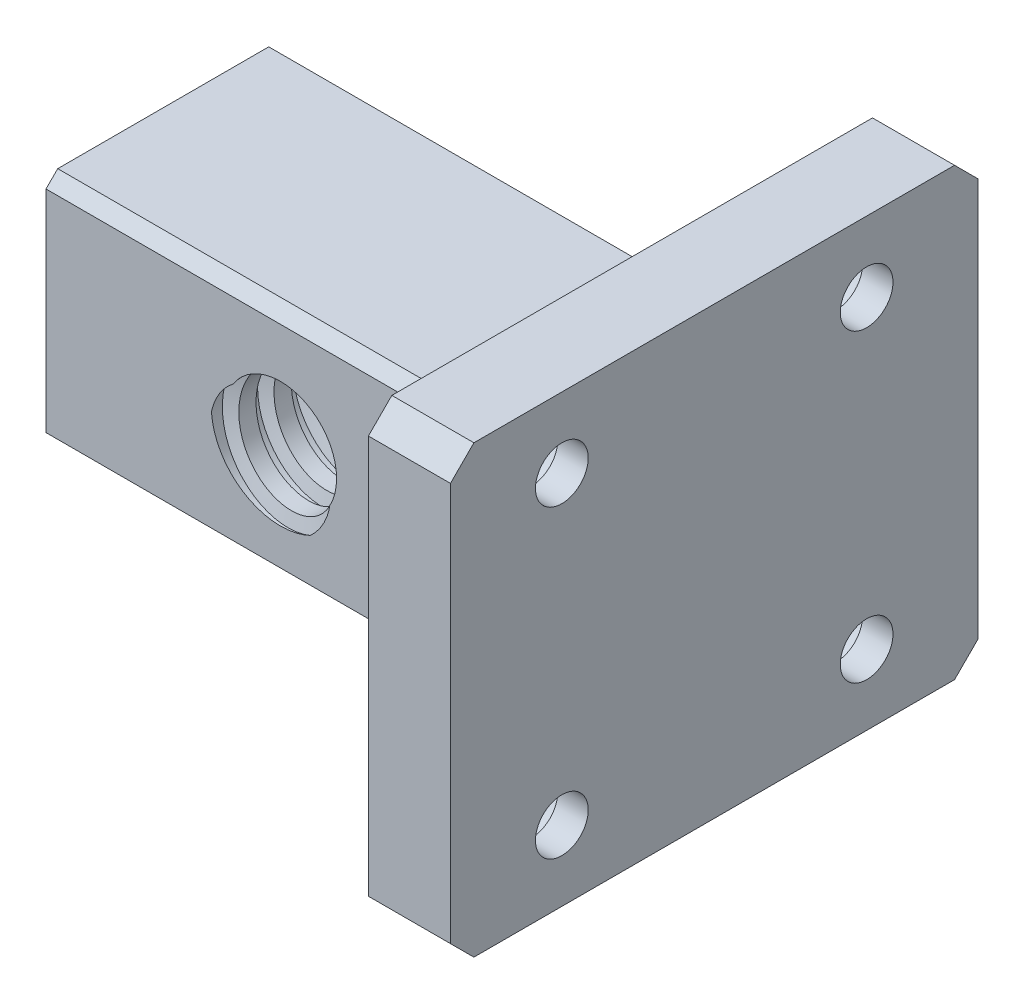
from build123d import *

# Parameters (mm, degrees)
SKETCH1_W                                           = 40
SKETCH1_H                                           = 20
BOSS_EXTRUDE1_DEPTH                                 = 20
CUT_EXTRUDE2_REACH                                  = 32
SKETCH2_R                                           = 4.788348304
CUT_SWEEP1_PITCH                                    = 3
SKETCH10_W                                          = 45
SKETCH10_H                                          = 38
EXTRUDE1_DEPTH                                      = 7
CHAMFER1_SIZE                                       = 2
CBORE_FOR_M4_HEX_SOCKET_HEAD_CAP_SCREW2_D           = 4.5
CBORE_FOR_M4_HEX_SOCKET_HEAD_CAP_SCREW2_CBORE_D     = 8
CBORE_FOR_M4_HEX_SOCKET_HEAD_CAP_SCREW2_CBORE_DEPTH = 4.4
CHAMFER2_SIZE                                       = 1


with BuildPart() as part:
    # Sketch1 → Boss-Extrude1 (new body)
    with BuildSketch(Plane.XY):
        Rectangle(SKETCH1_W, SKETCH1_H)
    extrude(amount=BOSS_EXTRUDE1_DEPTH)

    # Sketch2 → Cut-Extrude2 (cut, up to next)
    with BuildSketch(Plane.XY.offset(20), mode=Mode.PRIVATE) as cut_extrude2_sk1:
        Circle(SKETCH2_R)
    cut_extrude2_tool1 = extrude(cut_extrude2_sk1.sketch, amount=-CUT_EXTRUDE2_REACH, mode=Mode.PRIVATE) & part.part
    add(cut_extrude2_tool1.solids().sort_by_distance((0, 0, 20))[0], mode=Mode.SUBTRACT)

    # Cut-Sweep1: the profile of Sketch8 screwed along a right-hand helix of 11 turns, 10 arcs to a turn; built about Z, then put on its axis
    cut_sweep1_z = Axis((0, 0, 0), (0, 0, 1))
    cut_sweep1_corners = [(3.9, 0, 0), (3.9, 0.243039156, -1.98517807), (5.9, 0.17791701, -1.453251209), (5.9, 0.065122146, -0.531926861)]
    with BuildLine(mode=Mode.PRIVATE) as cut_sweep1_profile:
        Line(cut_sweep1_corners[0], cut_sweep1_corners[1])
        Line(cut_sweep1_corners[1], cut_sweep1_corners[2])
        Line(cut_sweep1_corners[2], cut_sweep1_corners[3])
        Line(cut_sweep1_corners[3], cut_sweep1_corners[0])
    cut_sweep1_cap = Face(cut_sweep1_profile.wire())
    cut_sweep1_turn_angles = [0, 18, 36, 54, 72, 90, 108, 126, 144, 162, 180, 198, 216, 234, 252, 270, 288, 306, 324, 342, 360]
    cut_sweep1_turn_weights = [1, 0.9510565162951535, 1, 0.9510565162951535, 1, 0.9510565162951535, 1, 0.9510565162951535, 1, 0.9510565162951535, 1, 0.9510565162951535, 1, 0.9510565162951535, 1, 0.9510565162951535, 1, 0.9510565162951535, 1, 0.9510565162951535, 1]
    cut_sweep1_turn_rails = [Edge.make_bspline([Vector(p[0], p[1], 0).rotate(cut_sweep1_z, cut_sweep1_turn_angles[k]) / cut_sweep1_turn_weights[k] + Vector(0, 0, p[2] + CUT_SWEEP1_PITCH * cut_sweep1_turn_angles[k] / 360) for k in range(21)], [0, 0, 0, 1, 1, 2, 2, 3, 3, 4, 4, 5, 5, 6, 6, 7, 7, 8, 8, 9, 9, 10, 10, 10], 2, cut_sweep1_turn_weights) for p in cut_sweep1_corners]
    cut_sweep1_turn_sides = [Face.make_surface_from_curves(cut_sweep1_turn_rails[p[0]], cut_sweep1_turn_rails[p[1]]) for p in [(0, 1), (1, 2), (2, 3), (3, 0)]]
    cut_sweep1 = Plane(origin=(0, 0, 20), x_dir=(1, 0, 0), z_dir=(0, 0, -1)) * Solid(Shell([*[p.moved(Location((0, 0, CUT_SWEEP1_PITCH * i))) for i in range(11) for p in cut_sweep1_turn_sides], cut_sweep1_cap, cut_sweep1_cap.rotate(cut_sweep1_z, 3960).moved(Location((0, 0, CUT_SWEEP1_PITCH * 3960 / 360)))]))
    add(cut_sweep1, mode=Mode.SUBTRACT)

    # Sketch10 → Extrude1 (add)
    with BuildSketch(Plane(origin=(20, 0, 0), x_dir=(0, 0, -1), z_dir=(1, 0, 0))):
        with Locations((-10, 0)):
            Rectangle(SKETCH10_W, SKETCH10_H)
    extrude(amount=EXTRUDE1_DEPTH)

    # Chamfer1
    chamfer1_edges = [part.edges().sort_by_distance(p)[0] for p in [
        (23.5, 19, 32.5),
        (23.5, -19, 32.5),
        (23.5, -19, -12.5),
        (23.5, 19, -12.5),
    ]]
    chamfer(chamfer1_edges, length=CHAMFER1_SIZE)

    # CBORE for M4 Hex Socket Head Cap Screw2 (through all)
    with Locations(Plane.ZY.offset(-20)):
        with Locations((23, 13), (23, -13), (-3, -13), (-3, 13)):
            CounterBoreHole(CBORE_FOR_M4_HEX_SOCKET_HEAD_CAP_SCREW2_D / 2, CBORE_FOR_M4_HEX_SOCKET_HEAD_CAP_SCREW2_CBORE_D / 2, CBORE_FOR_M4_HEX_SOCKET_HEAD_CAP_SCREW2_CBORE_DEPTH)

    # Chamfer2
    chamfer2_edges = [part.edges().sort_by_distance(p)[0] for p in [
        (0, -10, 20),
        (0, -10, 0),
        (0, 10, 0),
        (0, 10, 20),
    ]]
    chamfer(chamfer2_edges, length=CHAMFER2_SIZE)


solid = part.part
